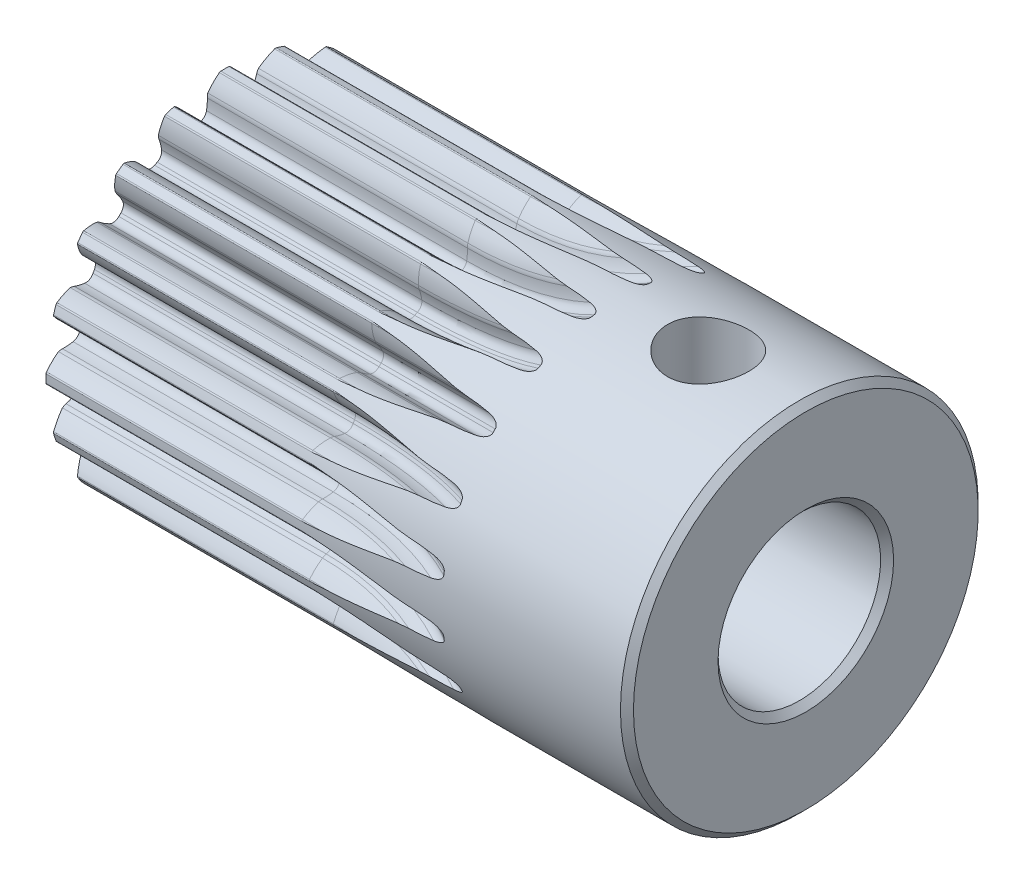
from build123d import *

# Parameters (mm, degrees)
CHAMFER1_SIZE       = 0.2
CHAMFER1_2_SIZE     = 0.2
CIRPATTERN1_COUNT   = 20
TAPPED_HOLE1_REACH  = 23.8
TAPPED_HOLE1_BORE_R = 1.25


with BuildPart() as part:
    # Sketch1 → Revolve1 (revolve)
    with BuildSketch(Plane.XY, mode=Mode.PRIVATE) as revolve1_sk:
        Polygon((0.133974596, 5.5), (0, 5), (0, 2.5), (18, 2.5), (18, 5.5), align=None)
    revolve(revolve1_sk.sketch.rotate(Axis((0, 0, 0), (1, 0, 0)), 90), axis=Axis((0, 0, 0), (1, 0, 0)))

    # Chamfer1
    chamfer1_edges = [part.edges().sort_by_distance(p)[0] for p in [
        (18, 0, -5.5),
    ]]
    chamfer(chamfer1_edges, length=CHAMFER1_SIZE)

    # Chamfer1 2
    chamfer1_2_edges = [part.edges().sort_by_distance(p)[0] for p in [
        (18, 0, -2.5),
        (0, 0, -2.5),
    ]]
    chamfer(chamfer1_2_edges, length=CHAMFER1_2_SIZE)

    # Cut-Sweep1: sweep along a path in Sketch4
    with BuildLine(Plane(origin=(0, 0, 0), x_dir=(1, 0, 0), z_dir=(0, 0.15643446504023126, 0.9876883405951378))) as cut_sweep1_path:
        Line((0, 4.375), (8, 4.375))
        ThreePointArc((8, 4.375), (10.224859546, 4.660894058), (12.305156792, 5.5))
    # Sketch3 → Cut-Sweep1 (sweep, cut)
    with BuildSketch(Plane.ZY):
        with BuildLine():
            ThreePointArc((-0.164204784, 5.476741427), (-0.298406822, 5.240005731), (-0.392295479, 4.984586669))
            ThreePointArc((-0.392295479, 4.984586669), (-0.404355714, 4.922996806), (-0.406806078, 4.860285115))
            ThreePointArc((-0.406806078, 4.860285115), (-0.409374255, 4.695261107), (-0.429605712, 4.531461818))
            ThreePointArc((-0.429605712, 4.531461818), (-0.501607773, 4.395969674), (-0.639193937, 4.328054541))
            ThreePointArc((-0.639193937, 4.328054541), (-0.684400785, 4.32113649), (-0.729532846, 4.313746264))
            ThreePointArc((-0.729532846, 4.313746264), (-0.881371995, 4.33582093), (-0.991719399, 4.442431756))
            ThreePointArc((-0.991719399, 4.442431756), (-1.061577422, 4.591962273), (-1.115015127, 4.748115821))
            ThreePointArc((-1.115015127, 4.748115821), (-1.13672454, 4.80700098), (-1.167226819, 4.861849602))
            ThreePointArc((-1.167226819, 4.861849602), (-1.335449069, 5.075754375), (-1.536238145, 5.259432691))
            ThreePointArc((-1.536238145, 5.259432691), (-1.557724251, 5.269066255), (-1.581236978, 5.267797416))
            ThreePointArc((-1.581236978, 5.267797416), (-0.860389558, 5.432285873), (-0.123993193, 5.498602158))
            ThreePointArc((-0.123993193, 5.498602158), (-0.146747218, 5.492543063), (-0.164204784, 5.476741427))
        make_face()
    cut_sweep1 = sweep(path=cut_sweep1_path.line, mode=Mode.SUBTRACT)

    # CirPattern1: Cut-Sweep1 ×20 about axis
    cirpattern1_axis = Axis((0, 0, 0), (1, 0, 0))
    for i in range(1, CIRPATTERN1_COUNT):
        add(cut_sweep1.rotate(cirpattern1_axis, i * 360 / CIRPATTERN1_COUNT), mode=Mode.SUBTRACT)

    # Tapped Hole1 bore → Tapped Hole1 (cut, up to next)
    with BuildSketch(Plane(origin=(0, 5.5, 0), x_dir=(1, 0, 0), z_dir=(0, 1, 0)), mode=Mode.PRIVATE) as tapped_hole1_sk1:
        with Locations((15, 0)):
            Circle(TAPPED_HOLE1_BORE_R)
    tapped_hole1_tool1 = extrude(tapped_hole1_sk1.sketch, amount=-TAPPED_HOLE1_REACH, mode=Mode.PRIVATE) & part.part
    add(tapped_hole1_tool1.solids().sort_by_distance((15, 5.5, 0))[0], mode=Mode.SUBTRACT)


solid = part.part
